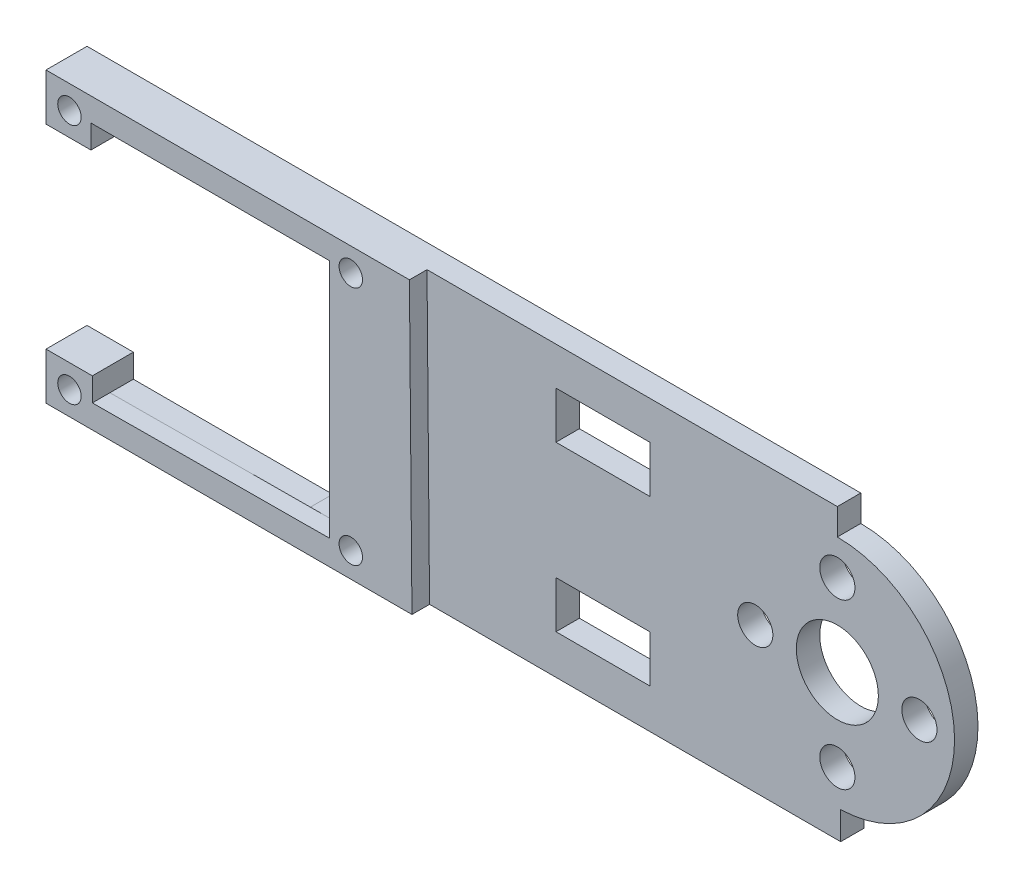
from build123d import *

# Parameters (mm, degrees)
SKETCH1_R           = 1
SKETCH1_R_2         = 1.5
SKETCH1_R_3         = 3.5
SKETCH1_W           = 8
SKETCH1_H           = 4
BOSS_EXTRUDE1_DEPTH = 2
BOSS_EXTRUDE2_DEPTH = 1.5
SKETCH6_R           = 1
CUT_EXTRUDE1_DEPTH  = 52.625777951


with BuildPart() as part:
    # Sketch1 → Boss-Extrude1 (new body)
    with BuildSketch(Plane.XY):
        with BuildLine():
            Line((-5.166471095, 12.25), (-17.166471095, 12.25))
            Line((-17.166471095, 12.25), (-26, 12.25))
            Line((-26, 12.25), (-26, 8.25))
            Line((-26, 8.25), (-25, 8.25))
            Line((-25, 8.25), (-22.166471095, 8.25))
            Line((-22.166471095, 8.25), (-22.166471095, 10.25))
            Line((-22.166471095, 10.25), (-17.166471095, 10.25))
            Line((-17.166471095, 10.25), (-5.048221431, 10.25))
            Line((-5.048221431, 10.25), (-1.798221431, 10.25))
            Line((-1.798221431, 10.25), (-1.798221431, -10.25))
            Line((-1.798221431, -10.25), (-5.048221431, -10.368142505))
            Line((-5.048221431, -10.368142505), (-17.048221431, -10.368142505))
            Line((-17.048221431, -10.368142505), (-22.048221431, -10.368142505))
            Line((-22.048221431, -10.368142505), (-22.048221431, -8.368142505))
            Line((-22.048221431, -8.368142505), (-26, -8.368142505))
            Line((-26, -8.368142505), (-26, -12.368142505))
            Line((-26, -12.368142505), (-24, -12.368142505))
            Line((-24, -12.368142505), (-17.048221431, -12.368142505))
            Line((-17.048221431, -12.368142505), (-5.048221431, -12.368142505))
            Line((-5.048221431, -12.368142505), (5.21629802, -12.368142505))
            Line((5.21629802, -12.368142505), (40.284720759, -12.368142505))
            Line((40.284720759, -12.368142505), (40.284720759, -9.995945883))
            ThreePointArc((40.284720759, -9.995945883), (49.998986419, 0.142374811), (40, 10))
            Line((40, 10), (40, 12.25))
            Line((40, 12.25), (5, 12.25))
            Line((5, 12.25), (-5.166471095, 12.25))
        make_face()
        with Locations((0, 10.25)):
            Circle(SKETCH1_R, mode=Mode.SUBTRACT)
        with Locations((0, -10.25)):
            Circle(SKETCH1_R, mode=Mode.SUBTRACT)
        with Locations((40, 7)):
            Circle(SKETCH1_R_2, mode=Mode.SUBTRACT)
        with Locations((47, 0)):
            Circle(SKETCH1_R_2, mode=Mode.SUBTRACT)
        with Locations((40, -7)):
            Circle(SKETCH1_R_2, mode=Mode.SUBTRACT)
        with Locations((33, 0)):
            Circle(SKETCH1_R_2, mode=Mode.SUBTRACT)
        with Locations((40, 0)):
            Circle(SKETCH1_R_3, mode=Mode.SUBTRACT)
        with Locations((-24, 10.25)):
            Circle(SKETCH1_R, mode=Mode.SUBTRACT)
        with Locations((-24, -10.368142505)):
            Circle(SKETCH1_R, mode=Mode.SUBTRACT)
        with Locations((20, 7)):
            Rectangle(SKETCH1_W, SKETCH1_H, mode=Mode.SUBTRACT)
        with Locations((20, -7)):
            Rectangle(SKETCH1_W, SKETCH1_H, mode=Mode.SUBTRACT)
    extrude(amount=BOSS_EXTRUDE1_DEPTH)

    # Sketch5 → Boss-Extrude2 (add)
    with BuildSketch(Plane.XY.offset(2)):
        Polygon((5, 12.25), (5.21629802, -12.368142505), (-26, -12.368142505), (-26, -8.368142505), (-22.048221431, -8.368142505), (-22.048221431, -10.368142505), (-1.798221431, -10.25), (-1.798221431, 10.25), (-22.166471095, 10.25), (-22.166471095, 8.25), (-26, 8.25), (-26, 12.25), align=None)
    extrude(amount=BOSS_EXTRUDE2_DEPTH)

    # Sketch6 → Cut-Extrude1 (cut, through all)
    with BuildSketch(Plane(origin=(0, 0, 0), x_dir=(-1, 0, 0), z_dir=(0, 0, -1))):
        with Locations((0, 10.25)):
            Circle(SKETCH6_R)
        with Locations((0, -10.25)):
            Circle(SKETCH6_R)
        with Locations((24, -10.368142505)):
            Circle(SKETCH6_R)
        with Locations((24, 10.25)):
            Circle(SKETCH6_R)
    extrude(amount=-CUT_EXTRUDE1_DEPTH, mode=Mode.SUBTRACT)


solid = part.part
